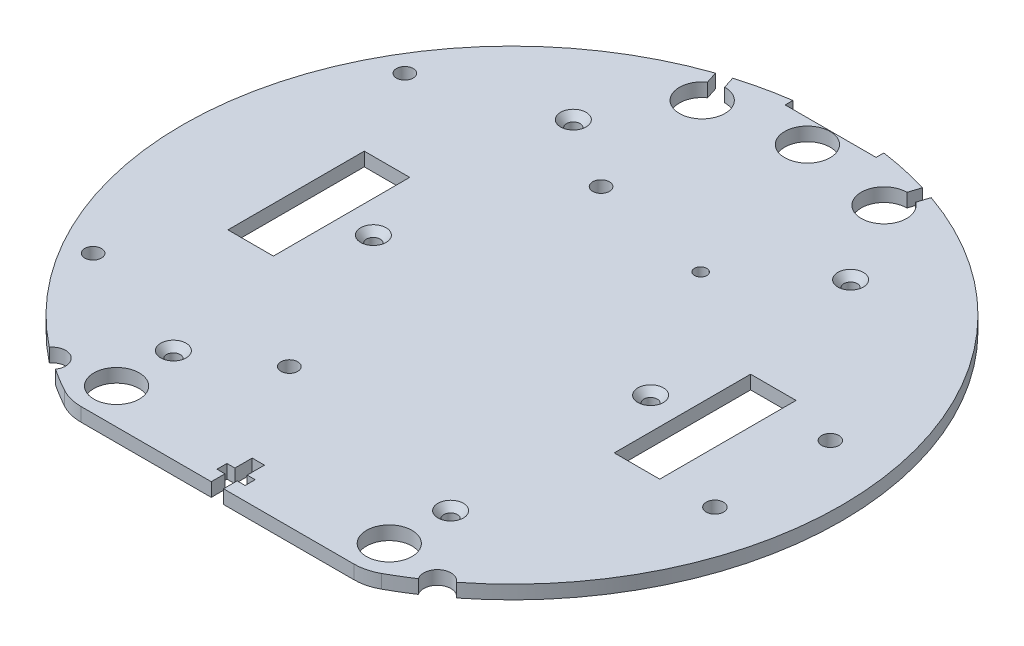
from build123d import *
from OCP.BRepFilletAPI import BRepFilletAPI_MakeChamfer

# Parameters (mm, degrees)
BOSS_EXTRUDE1_DEPTH = 3
SKETCH2_R           = 1.5
CUT_EXTRUDE1_DEPTH  = 103.574363269
CHAMFER1_SIZE       = 1.5
CHAMFER1_SIZE2      = 1.303930107
CUT_EXTRUDE2_DEPTH  = 103.574363269
SKETCH4_W           = 20
SKETCH4_H           = 1.7
CUT_EXTRUDE3_DEPTH  = 103.574363269
SKETCH5_R           = 5
CUT_EXTRUDE4_DEPTH  = 103.085748271
SKETCH6_R           = 1.8415
CUT_EXTRUDE5_DEPTH  = 103.085748271
SKETCH7_R           = 1.3716
CUT_EXTRUDE6_DEPTH  = 103.085748271
SKETCH8_R           = 1.905
SKETCH8_W           = 10
SKETCH8_H           = 30
CUT_EXTRUDE7_DEPTH  = 103.085748271


with BuildPart() as part:
    # Sketch1 → Boss-Extrude1 (new body)
    with BuildSketch(Plane(origin=(0, 0, 0), x_dir=(1, 0, 0), z_dir=(0, 1, 0))):
        with BuildLine():
            Line((30.029977361, -64.812867647), (-30.029977361, -64.812867647))
            ThreePointArc((-30.029977361, -64.812867647), (-32.509837414, -64.500503794), (-34.834773739, -63.582926471))
            ThreePointArc((-34.834773739, -63.582926471), (0, 72.5), (34.834773739, -63.582926471))
            ThreePointArc((34.834773739, -63.582926471), (32.509837414, -64.500503794), (30.029977361, -64.812867647))
        make_face()
    extrude(amount=BOSS_EXTRUDE1_DEPTH)

    # Sketch2 → Cut-Extrude1 (cut, through all)
    with BuildSketch(Plane(origin=(0, 3, 0), x_dir=(1, 0, 0), z_dir=(0, 1, 0))):
        with Locations((-30.5, 44)):
            Circle(SKETCH2_R)
        with Locations((30.5, 44)):
            Circle(SKETCH2_R)
        with Locations((30.5, 0)):
            Circle(SKETCH2_R)
        with Locations((30.5, -44)):
            Circle(SKETCH2_R)
        with Locations((-30.5, -44)):
            Circle(SKETCH2_R)
        with Locations((-30.5, 0)):
            Circle(SKETCH2_R)
    extrude(amount=-CUT_EXTRUDE1_DEPTH, mode=Mode.SUBTRACT)

    # Chamfer1: one chamfer whose edges measure the first distance from different faces: ONE call of the kernel's chamfer builder (chamfer() names one face for all edges)
    chamfer1_edges_1 = [part.edges().sort_by_distance(p)[0] for p in [
        (29, 3, -44),
    ]]
    chamfer1_side_1 = [part.faces().sort_by_distance(p)[0] for p in [
        (29, 1.5, -44),
    ]]
    chamfer1_edges_2 = [part.edges().sort_by_distance(p)[0] for p in [
        (29, 3, 0),
    ]]
    chamfer1_side_2 = [part.faces().sort_by_distance(p)[0] for p in [
        (29, 1.5, 0),
    ]]
    chamfer1_edges_3 = [part.edges().sort_by_distance(p)[0] for p in [
        (29, 3, 44),
    ]]
    chamfer1_side_3 = [part.faces().sort_by_distance(p)[0] for p in [
        (29, 1.5, 44),
    ]]
    chamfer1_edges_4 = [part.edges().sort_by_distance(p)[0] for p in [
        (-32, 3, 44),
    ]]
    chamfer1_side_4 = [part.faces().sort_by_distance(p)[0] for p in [
        (-32, 1.5, 44),
    ]]
    chamfer1_edges_5 = [part.edges().sort_by_distance(p)[0] for p in [
        (-32, 3, 0),
    ]]
    chamfer1_side_5 = [part.faces().sort_by_distance(p)[0] for p in [
        (-32, 1.5, 0),
    ]]
    chamfer1_edges_6 = [part.edges().sort_by_distance(p)[0] for p in [
        (-32, 3, -44),
    ]]
    chamfer1_side_6 = [part.faces().sort_by_distance(p)[0] for p in [
        (-32, 1.5, -44),
    ]]
    chamfer1 = BRepFilletAPI_MakeChamfer(part.part.solid().wrapped)
    for e in chamfer1_edges_1:
        chamfer1.Add(CHAMFER1_SIZE, CHAMFER1_SIZE2, e.wrapped, chamfer1_side_1[0].wrapped)  # the first distance lies on this face
    for e in chamfer1_edges_2:
        chamfer1.Add(CHAMFER1_SIZE, CHAMFER1_SIZE2, e.wrapped, chamfer1_side_2[0].wrapped)  # the first distance lies on this face
    for e in chamfer1_edges_3:
        chamfer1.Add(CHAMFER1_SIZE, CHAMFER1_SIZE2, e.wrapped, chamfer1_side_3[0].wrapped)  # the first distance lies on this face
    for e in chamfer1_edges_4:
        chamfer1.Add(CHAMFER1_SIZE, CHAMFER1_SIZE2, e.wrapped, chamfer1_side_4[0].wrapped)  # the first distance lies on this face
    for e in chamfer1_edges_5:
        chamfer1.Add(CHAMFER1_SIZE, CHAMFER1_SIZE2, e.wrapped, chamfer1_side_5[0].wrapped)  # the first distance lies on this face
    for e in chamfer1_edges_6:
        chamfer1.Add(CHAMFER1_SIZE, CHAMFER1_SIZE2, e.wrapped, chamfer1_side_6[0].wrapped)  # the first distance lies on this face
    add(Compound.cast(chamfer1.Shape()), mode=Mode.REPLACE)

    # Sketch3 → Cut-Extrude2 (cut, through all)
    with BuildSketch(Plane(origin=(0, 3, 0), x_dir=(1, 0, 0), z_dir=(0, 1, 0))):
        Polygon((1.35, -61.812867647), (3.1, -61.812867647), (3.1, -59.612867647), (1.35, -59.612867647), (1.35, -55.812867647), (-1.35, -55.812867647), (-1.35, -59.612867647), (-3.1, -59.612867647), (-3.1, -61.812867647), (-1.35, -61.812867647), (-1.35, -64.812867647), (1.35, -64.812867647), align=None)
    extrude(amount=-CUT_EXTRUDE2_DEPTH, mode=Mode.SUBTRACT)

    # Sketch4 → Cut-Extrude3 (cut, through all)
    with BuildSketch(Plane(origin=(0, 3, 0), x_dir=(1, 0, 0), z_dir=(0, 1, 0))):
        with Locations((0, 70.957033082)):
            Rectangle(SKETCH4_W, SKETCH4_H)
    extrude(amount=-CUT_EXTRUDE3_DEPTH, mode=Mode.SUBTRACT)


with BuildPart() as body_2:
    # of the pieces the cut leaves, the one that is kept (cut_extrude3_keep)
    add(part.part.solids().sort_by_distance((-30.029977361, 3, 64.812867647))[0])

    # Sketch5 → Cut-Extrude4 (cut, through all)
    with BuildSketch(Plane(origin=(0, 3, 0), x_dir=(1, 0, 0), z_dir=(0, 1, 0))):
        with Locations((0, 65)):
            Circle(SKETCH5_R)
        with Locations((30, -57)):
            Circle(SKETCH5_R)
        with Locations((-30, -57)):
            Circle(SKETCH5_R)
    extrude(amount=-CUT_EXTRUDE4_DEPTH, mode=Mode.SUBTRACT)

    # Sketch6 → Cut-Extrude5 (cut, through all)
    with BuildSketch(Plane(origin=(0, 3, 0), x_dir=(1, 0, 0), z_dir=(0, 1, 0))):
        with Locations((-57.871763918, 34.29)):
            Circle(SKETCH6_R)
        with Locations((-57.871763918, -34.29)):
            Circle(SKETCH6_R)
        with Locations((-14.691763918, -34.29)):
            Circle(SKETCH6_R)
        with Locations((-14.691763918, 34.29)):
            Circle(SKETCH6_R)
    extrude(amount=-CUT_EXTRUDE5_DEPTH, mode=Mode.SUBTRACT)

    # Sketch7 → Cut-Extrude6 (cut, through all)
    with BuildSketch(Plane(origin=(0, 3, 0), x_dir=(1, 0, 0), z_dir=(0, 1, 0))):
        with Locations((12.523236082, 28.985)):
            Circle(SKETCH7_R)
    extrude(amount=-CUT_EXTRUDE6_DEPTH, mode=Mode.SUBTRACT)

    # Sketch8 → Cut-Extrude7 (cut, through all)
    with BuildSketch(Plane(origin=(0, 3, 0), x_dir=(1, 0, 0), z_dir=(0, 1, 0))):
        with Locations((58.901130478, -14.258905917)):
            Circle(SKETCH8_R)
        with Locations((58.901130478, 11.141094083)):
            Circle(SKETCH8_R)
        with Locations((-42.5, 0)):
            Rectangle(SKETCH8_W, SKETCH8_H)
        with Locations((42.5, 0)):
            Rectangle(SKETCH8_W, SKETCH8_H)
        with BuildLine():
            Line((-23.730146131, 68.506424258), (-22.894827642, 65.923344486))
            ThreePointArc((-22.894827642, 65.923344486), (-18.461538462, 57.089154816), (-20.040369901, 66.846421409))
            Line((-20.040369901, 66.846421409), (-20.87568839, 69.429501181))
            ThreePointArc((-20.87568839, 69.429501181), (-22.764455722, 70.39519159), (-23.730146131, 68.506424258))
        make_face()
        with BuildLine():
            Line((20.040369901, 66.846421409), (20.87568839, 69.429501181))
            ThreePointArc((20.87568839, 69.429501181), (22.764455722, 70.39519159), (23.730146131, 68.506424258))
            Line((23.730146131, 68.506424258), (22.894827642, 65.923344486))
            ThreePointArc((22.894827642, 65.923344486), (18.461538462, 57.089154816), (20.040369901, 66.846421409))
        make_face()
        with BuildLine():
            ThreePointArc((39.925125077, -60.516397675), (40.640278394, -56.379231744), (44.791355024, -57.008635443))
            ThreePointArc((44.791355024, -57.008635443), (42.394535015, -58.812867647), (39.925125077, -60.516397675))
        make_face()
        with BuildLine():
            ThreePointArc((-39.925125077, -60.516397675), (-40.640278394, -56.379231744), (-44.791355024, -57.008635443))
            ThreePointArc((-44.791355024, -57.008635443), (-42.394535015, -58.812867647), (-39.925125077, -60.516397675))
        make_face()
    extrude(amount=-CUT_EXTRUDE7_DEPTH, mode=Mode.SUBTRACT)


solid = body_2.part
